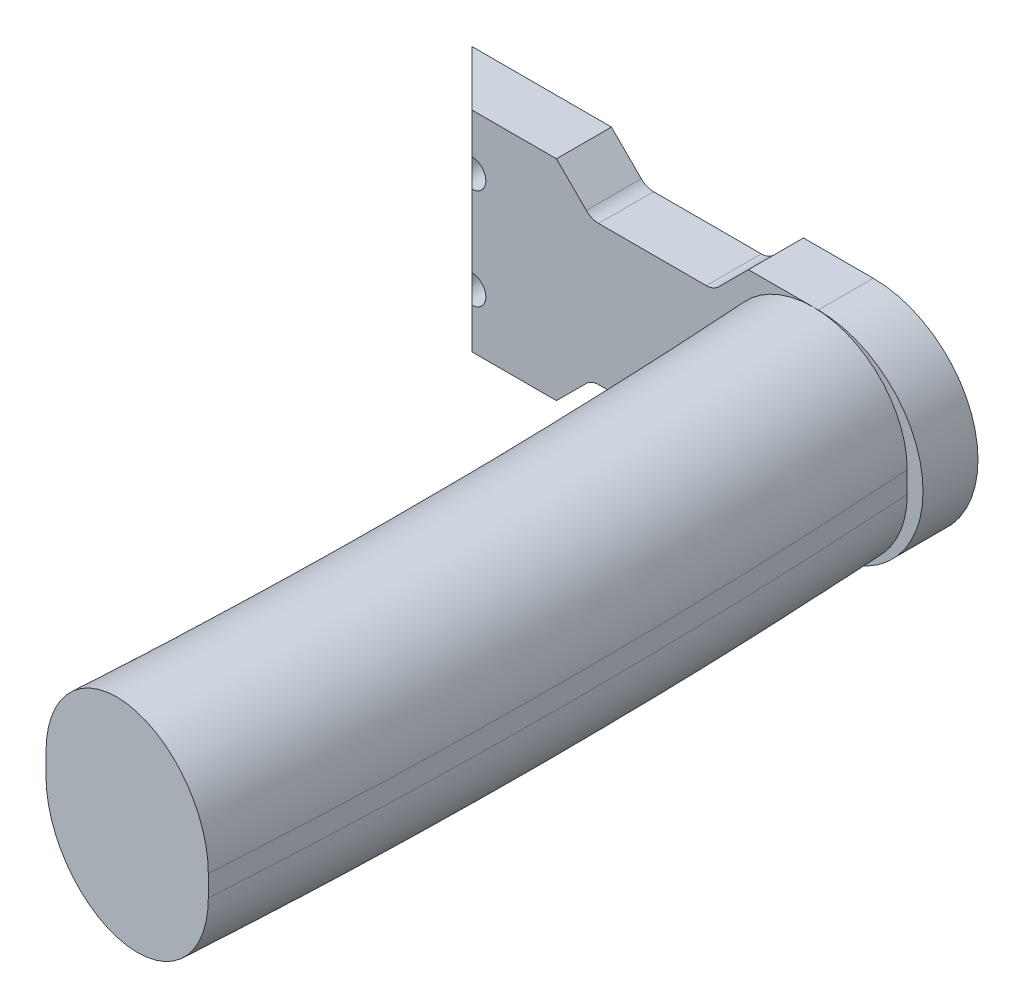
from build123d import *

# Parameters (mm, degrees)
BOSS_EXTRUDE1_DEPTH         = 10
CHAMFER1_SIZE               = 10
F_1_4_20_TAPPED_HOLE1_D     = 5.1054
F_1_4_20_TAPPED_HOLE1_DEPTH = 16.51


with BuildPart() as part:
    # Sketch1 → Boss-Extrude1 (new body)
    with BuildSketch(Plane.XY):
        with BuildLine():
            Line((0, -19.05), (0, 19.05))
            Line((0, 19.05), (25.4, 19.05))
            Line((25.4, 19.05), (30.82006403, 13.62993597))
            ThreePointArc((30.82006403, 13.62993597), (31.850108163, 12.941682484), (33.065128061, 12.7))
            Line((33.065128061, 12.7), (52.659871939, 12.7))
            ThreePointArc((52.659871939, 12.7), (53.874891837, 12.941682484), (54.90493597, 13.62993597))
            Line((54.90493597, 13.62993597), (60.325, 19.05))
            Line((60.325, 19.05), (73.025, 19.05))
            ThreePointArc((73.025, 19.05), (92.075, 0), (73.025, -19.05))
            Line((73.025, -19.05), (60.325, -19.05))
            Line((60.325, -19.05), (54.90493597, -13.62993597))
            ThreePointArc((54.90493597, -13.62993597), (53.874891837, -12.941682484), (52.659871939, -12.7))
            Line((52.659871939, -12.7), (33.065128061, -12.7))
            ThreePointArc((33.065128061, -12.7), (31.850108163, -12.941682484), (30.82006403, -13.62993597))
            Line((30.82006403, -13.62993597), (25.4, -19.05))
            Line((25.4, -19.05), (0, -19.05))
        make_face()
    extrude(amount=BOSS_EXTRUDE1_DEPTH)

    # Chamfer1
    chamfer1_edges = [part.edges().sort_by_distance(p)[0] for p in [
        (0, 0, 10),
    ]]
    chamfer(chamfer1_edges, length=CHAMFER1_SIZE - 0.0001)  # a hair under: the kernel refuses the full size

    # 1/4-20 Tapped Hole1
    with Locations(Plane(origin=(0, 0, 0), x_dir=(-1, 0, 0), z_dir=(0, 0, -1))):
        with Locations((-10, -9.144), (-10, 9.144)):
            Hole(F_1_4_20_TAPPED_HOLE1_D / 2, depth=F_1_4_20_TAPPED_HOLE1_DEPTH)

    # Sweep1: sweep along a path in Sketch8
    with BuildLine(Plane(origin=(0, 0, 0), x_dir=(1, 0, 0), z_dir=(0, 1, 0))) as sweep1_path:
        ThreePointArc((88.281159976, -10), (90.343330416, -73.5), (88.281159976, -137))
    # Sketch5 → Sweep1 (sweep)
    with BuildSketch(Plane.XY.offset(10)):
        with BuildLine():
            Line((89.202450062, -1.925597754), (89.202450062, 1.925597754))
            ThreePointArc((89.202450062, 1.925597754), (72.078047816, 19.05), (54.953645569, 1.925597754))
            Line((54.953645569, 1.925597754), (54.953645569, -1.925597754))
            ThreePointArc((54.953645569, -1.925597754), (72.078047816, -19.05), (89.202450062, -1.925597754))
        make_face()
    sweep(path=sweep1_path.line)


solid = part.part
